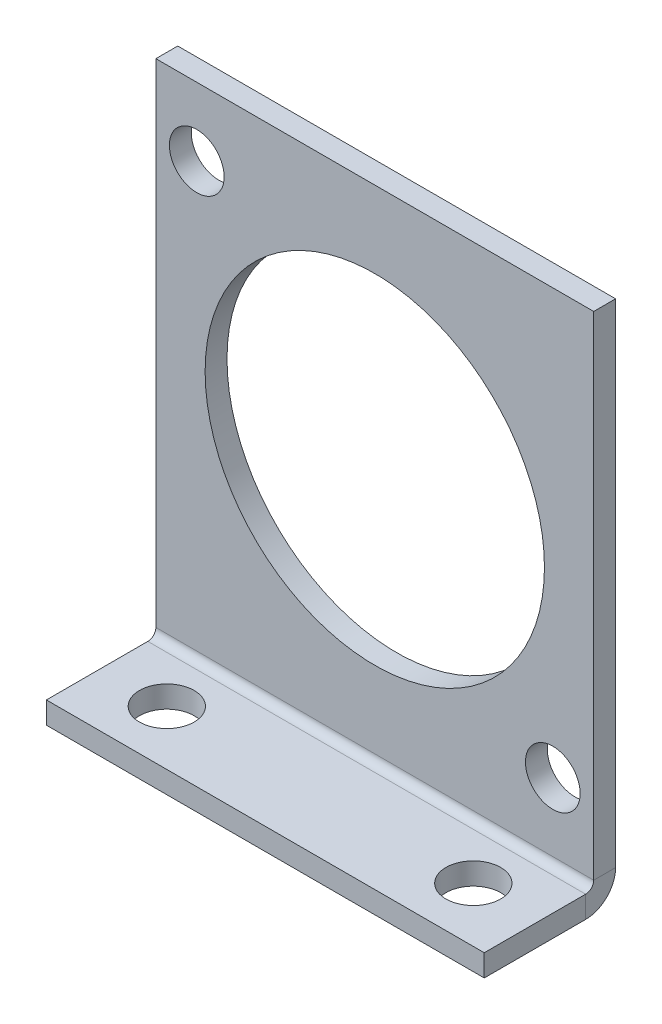
from build123d import *

# Parameters (mm, degrees)
SKETCH1_W          = 40
SKETCH1_H          = 45
BASE_FLANGE1_DEPTH = 2
SKETCH8_R          = 15.5
CUT_EXTRUDE5_DEPTH = 31.170349683
SKETCH9_R          = 2.5
CUT_EXTRUDE6_DEPTH = 31.170349683
EDGE_FLANGE1_DEPTH = 40
SKETCH13_R         = 2.5
CUT_EXTRUDE7_DEPTH = 53.714162988


# Sheet-metal steps are written as plain solids
with BuildPart() as part:
    # Sketch1 → Base-Flange1 (new body)
    with BuildSketch(Plane.XY):
        Rectangle(SKETCH1_W, SKETCH1_H)
    extrude(amount=-BASE_FLANGE1_DEPTH)

    # Sketch8 → Cut-Extrude5 (cut, through all)
    with BuildSketch(Plane.XY):
        Circle(SKETCH8_R)
    extrude(amount=-CUT_EXTRUDE5_DEPTH, mode=Mode.SUBTRACT)

    # Sketch9 → Cut-Extrude6 (cut, through all)
    with BuildSketch(Plane.XY):
        with Locations((-16.263455967, 16.263455967)):
            Circle(SKETCH9_R)
        with Locations((16.263455967, -16.263455967)):
            Circle(SKETCH9_R)
    extrude(amount=-CUT_EXTRUDE6_DEPTH, mode=Mode.SUBTRACT)

    # Edge-Flange1 section (across the edge) → Edge-Flange1 (add)
    with BuildSketch(Plane(origin=(-20, -23.2366, 0), x_dir=(0, 1, 0), z_dir=(1, 0, 0))):
        with BuildLine():
            Line((-2, 0.7366), (-2, 10))
            Line((-2, 10), (0, 10))
            Line((0, 10), (0, 0.7366))
            ThreePointArc((0, 0.7366), (0.215745145, 0.215745145), (0.7366, 0))
            Line((0.7366, 0), (0.7366, -2))
            ThreePointArc((0.7366, -2), (-1.198468417, -1.198468417), (-2, 0.7366))
        make_face()
    extrude(amount=EDGE_FLANGE1_DEPTH)

    # Sketch13 → Cut-Extrude7 (cut, through all)
    with BuildSketch(Plane.XZ.offset(25.2366)):
        with Locations(Location((-14, 5, 0), (0, 0, 270))):
            Circle(SKETCH13_R)
        with Locations(Location((14, 5, 0), (0, 0, 270))):
            Circle(SKETCH13_R)
    extrude(amount=-CUT_EXTRUDE7_DEPTH, mode=Mode.SUBTRACT)


solid = part.part
